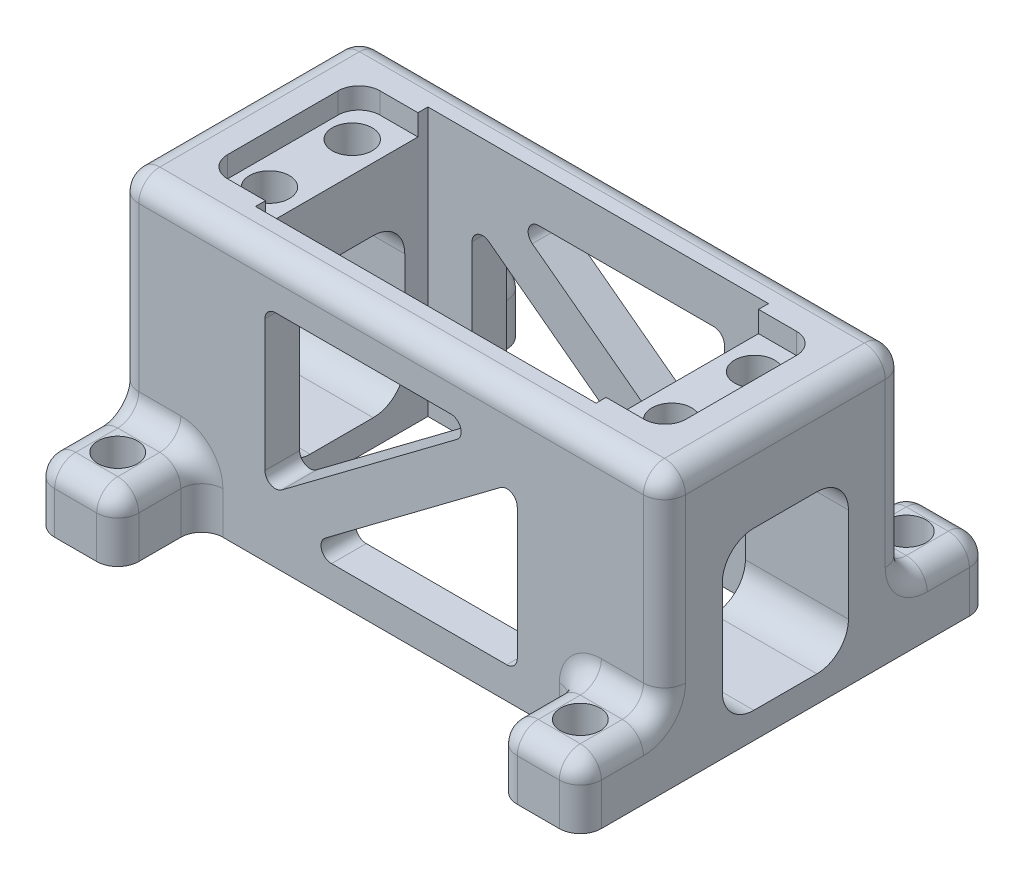
from build123d import *

# Parameters (mm, degrees)
SKETCH1_W           = 66.04
SKETCH1_H           = 29.21
SKETCH1_W_2         = 41.148
SKETCH1_H_2         = 20.828
BOSS_EXTRUDE1_DEPTH = 32.385
CUT_EXTRUDE1_DEPTH  = 2.54
SKETCH3_R           = 2.413
CUT_EXTRUDE2_DEPTH  = 10.16
SKETCH4_W           = 10.16
SKETCH4_H           = 10.16
BOSS_EXTRUDE2_DEPTH = 7.62
SKETCH5_R           = 2.3876
CUT_EXTRUDE3_DEPTH  = 53.463452517
FILLET1_R           = 2.54
CUT_EXTRUDE4_DEPTH  = 78.610405552
CUT_EXTRUDE5_REACH  = 62.738
CUT_EXTRUDE6_REACH  = 62.738


with BuildPart() as part:
    # Sketch1 → Boss-Extrude1 (new body)
    with BuildSketch(Plane(origin=(0, 0, 0), x_dir=(1, 0, 0), z_dir=(0, 1, 0))):
        Rectangle(SKETCH1_W, SKETCH1_H)
        Rectangle(SKETCH1_W_2, SKETCH1_H_2, mode=Mode.SUBTRACT)
    extrude(amount=BOSS_EXTRUDE1_DEPTH)

    # Sketch2 → Cut-Extrude1 (cut)
    with BuildSketch(Plane(origin=(0, 32.385, 0), x_dir=(1, 0, 0), z_dir=(0, 1, 0))):
        with BuildLine():
            Line((20.574, 9.2075), (25.146, 9.2075))
            ThreePointArc((25.146, 9.2075), (26.942051224, 8.463551224), (27.686, 6.6675))
            Line((27.686, 6.6675), (27.686, -6.6675))
            ThreePointArc((27.686, -6.6675), (26.942051224, -8.463551224), (25.146, -9.2075))
            Line((25.146, -9.2075), (20.574, -9.2075))
            Line((20.574, -9.2075), (20.574, 9.2075))
        make_face()
        with BuildLine():
            Line((-20.574, -9.2075), (-25.146, -9.2075))
            ThreePointArc((-25.146, -9.2075), (-26.942051224, -8.463551224), (-27.686, -6.6675))
            Line((-27.686, -6.6675), (-27.686, 6.6675))
            ThreePointArc((-27.686, 6.6675), (-26.942051224, 8.463551224), (-25.146, 9.2075))
            Line((-25.146, 9.2075), (-20.574, 9.2075))
            Line((-20.574, 9.2075), (-20.574, -9.2075))
        make_face()
    extrude(amount=-CUT_EXTRUDE1_DEPTH, mode=Mode.SUBTRACT)

    # Sketch3 → Cut-Extrude2 (cut)
    with BuildSketch(Plane(origin=(0, 29.845, 0), x_dir=(1, 0, 0), z_dir=(0, 1, 0))):
        with Locations((24.3, -5)):
            Circle(SKETCH3_R)
        with Locations((24.3, 5)):
            Circle(SKETCH3_R)
        with Locations((-24.3, -5)):
            Circle(SKETCH3_R)
        with Locations((-24.3, 5)):
            Circle(SKETCH3_R)
    extrude(amount=-CUT_EXTRUDE2_DEPTH, mode=Mode.SUBTRACT)

    # Sketch4 → Boss-Extrude2 (add)
    with BuildSketch(Plane.XZ):
        with Locations((-27.94, 19.685)):
            Rectangle(SKETCH4_W, SKETCH4_H)
        with Locations((27.94, 19.685)):
            Rectangle(SKETCH4_W, SKETCH4_H)
        with Locations((-27.94, -19.685)):
            Rectangle(SKETCH4_W, SKETCH4_H)
        with Locations((27.94, -19.685)):
            Rectangle(SKETCH4_W, SKETCH4_H)
    extrude(amount=-BOSS_EXTRUDE2_DEPTH)

    # Sketch5 → Cut-Extrude3 (cut, through all)
    with BuildSketch(Plane.XZ):
        with Locations((27.94, 19.685)):
            Circle(SKETCH5_R)
        with Locations((27.94, -19.685)):
            Circle(SKETCH5_R)
        with Locations((-27.94, -19.685)):
            Circle(SKETCH5_R)
        with Locations((-27.94, 19.685)):
            Circle(SKETCH5_R)
    extrude(amount=-CUT_EXTRUDE3_DEPTH, mode=Mode.SUBTRACT)

    # Fillet1
    fillet1_edges = [part.edges().sort_by_distance(p)[0] for p in [
        (22.86, 3.81, -14.605),
        (33.02, 7.62, -19.685),
        (-22.86, 3.81, -14.605),
        (-33.02, 7.62, 19.685),
        (33.02, 7.62, 19.685),
        (-33.02, 32.385, 0),
        (33.02, 32.385, 0),
        (33.02, 3.81, -24.765),
        (22.86, 3.81, -24.765),
        (22.86, 7.62, -19.685),
        (27.94, 7.62, -24.765),
        (27.94, 7.62, -14.605),
        (0, 32.385, -14.605),
        (33.02, 20.0025, -14.605),
        (-22.86, 3.81, -24.765),
        (-33.02, 3.81, -24.765),
        (-27.94, 7.62, -24.765),
        (-22.86, 7.62, -19.685),
        (-27.94, 7.62, -14.605),
        (-33.02, 7.62, -19.685),
        (-33.02, 20.0025, -14.605),
        (-22.86, 3.81, 24.765),
        (-33.02, 3.81, 24.765),
        (22.86, 3.81, 24.765),
        (33.02, 3.81, 24.765),
        (-27.94, 7.62, 24.765),
        (27.94, 7.62, 24.765),
        (22.86, 7.62, 19.685),
        (-22.86, 7.62, 19.685),
        (22.86, 3.81, 14.605),
        (-22.86, 3.81, 14.605),
        (-27.94, 7.62, 14.605),
        (27.94, 7.62, 14.605),
        (0, 32.385, 14.605),
        (33.02, 20.0025, 14.605),
        (-33.02, 20.0025, 14.605),
    ]]
    fillet(fillet1_edges, radius=FILLET1_R)

    # Sketch6 → Cut-Extrude4 (cut, through all)
    with BuildSketch(Plane(origin=(33.02, 0, 0), x_dir=(0, 0, -1), z_dir=(1, 0, 0))):
        with BuildLine():
            Line((-3.81, 22.225), (3.81, 22.225))
            ThreePointArc((3.81, 22.225), (6.504076836, 21.109076836), (7.62, 18.415))
            Line((7.62, 18.415), (7.62, 6.985))
            ThreePointArc((7.62, 6.985), (6.504076836, 4.290923164), (3.81, 3.175))
            Line((3.81, 3.175), (-3.81, 3.175))
            ThreePointArc((-3.81, 3.175), (-6.504076836, 4.290923164), (-7.62, 6.985))
            Line((-7.62, 6.985), (-7.62, 18.415))
            ThreePointArc((-7.62, 18.415), (-6.504076836, 21.109076836), (-3.81, 22.225))
        make_face()
    extrude(amount=-CUT_EXTRUDE4_DEPTH, mode=Mode.SUBTRACT)

    # Sketch9 → Cut-Extrude5 (cut, up to next)
    with BuildSketch(Plane(origin=(0, 0, -14.605), x_dir=(-1, 0, 0), z_dir=(0, 0, -1)), mode=Mode.PRIVATE) as cut_extrude5_sk1:
        with BuildLine():
            Line((-13.97, 26.67), (7.196666667, 26.67))
            ThreePointArc((7.196666667, 26.67), (8.401494455, 25.801609263), (7.958666667, 24.384))
            Line((7.958666667, 24.384), (-13.208, 8.509))
            ThreePointArc((-13.208, 8.509), (-14.537961266, 8.389077467), (-15.24, 9.525))
            Line((-15.24, 9.525), (-15.24, 25.4))
            ThreePointArc((-15.24, 25.4), (-14.868025612, 26.298025612), (-13.97, 26.67))
        make_face()
    cut_extrude5_tool1 = extrude(cut_extrude5_sk1.sketch, amount=-CUT_EXTRUDE5_REACH, mode=Mode.PRIVATE) & part.part
    # Sketch9 → Cut-Extrude5 (cut, up to next)
    with BuildSketch(Plane(origin=(0, 0, -14.605), x_dir=(-1, 0, 0), z_dir=(0, 0, -1)), mode=Mode.PRIVATE) as cut_extrude5_sk2:
        with BuildLine():
            Line((-7.196666667, 3.81), (13.97, 3.81))
            ThreePointArc((13.97, 3.81), (14.868025612, 4.181974388), (15.24, 5.08))
            Line((15.24, 5.08), (15.24, 20.955))
            ThreePointArc((15.24, 20.955), (14.537961266, 22.090922533), (13.208, 21.971))
            Line((13.208, 21.971), (-7.958666667, 6.096))
            ThreePointArc((-7.958666667, 6.096), (-8.401494455, 4.678390737), (-7.196666667, 3.81))
        make_face()
    cut_extrude5_tool2 = extrude(cut_extrude5_sk2.sketch, amount=-CUT_EXTRUDE5_REACH, mode=Mode.PRIVATE) & part.part
    add(cut_extrude5_tool1.solids().sort_by_distance((6.606961, 20.102283, -14.605))[0], mode=Mode.SUBTRACT)
    add(cut_extrude5_tool2.solids().sort_by_distance((-6.606961, 10.377717, -14.605))[0], mode=Mode.SUBTRACT)

    # Sketch10 → Cut-Extrude6 (cut, up to next)
    with BuildSketch(Plane.XY.offset(14.605), mode=Mode.PRIVATE) as cut_extrude6_sk1:
        with BuildLine():
            Line((7.196666667, 26.67), (-13.97, 26.67))
            ThreePointArc((-13.97, 26.67), (-14.868025612, 26.298025612), (-15.24, 25.4))
            Line((-15.24, 25.4), (-15.24, 9.525))
            ThreePointArc((-15.24, 9.525), (-14.537961266, 8.389077467), (-13.208, 8.509))
            Line((-13.208, 8.509), (7.958666667, 24.384))
            ThreePointArc((7.958666667, 24.384), (8.401494455, 25.801609263), (7.196666667, 26.67))
        make_face()
    cut_extrude6_tool1 = extrude(cut_extrude6_sk1.sketch, amount=-CUT_EXTRUDE6_REACH, mode=Mode.PRIVATE) & part.part
    # Sketch10 → Cut-Extrude6 (cut, up to next)
    with BuildSketch(Plane.XY.offset(14.605), mode=Mode.PRIVATE) as cut_extrude6_sk2:
        with BuildLine():
            ThreePointArc((-7.958666667, 6.096), (-8.401494455, 4.678390737), (-7.196666667, 3.81))
            Line((-7.196666667, 3.81), (13.97, 3.81))
            ThreePointArc((13.97, 3.81), (14.868025612, 4.181974388), (15.24, 5.08))
            Line((15.24, 5.08), (15.24, 20.955))
            ThreePointArc((15.24, 20.955), (14.537961266, 22.090922533), (13.208, 21.971))
            Line((13.208, 21.971), (-7.958666667, 6.096))
        make_face()
    cut_extrude6_tool2 = extrude(cut_extrude6_sk2.sketch, amount=-CUT_EXTRUDE6_REACH, mode=Mode.PRIVATE) & part.part
    add(cut_extrude6_tool1.solids().sort_by_distance((-6.606961, 20.102283, 14.605))[0], mode=Mode.SUBTRACT)
    add(cut_extrude6_tool2.solids().sort_by_distance((6.606961, 10.377717, 14.605))[0], mode=Mode.SUBTRACT)


solid = part.part
